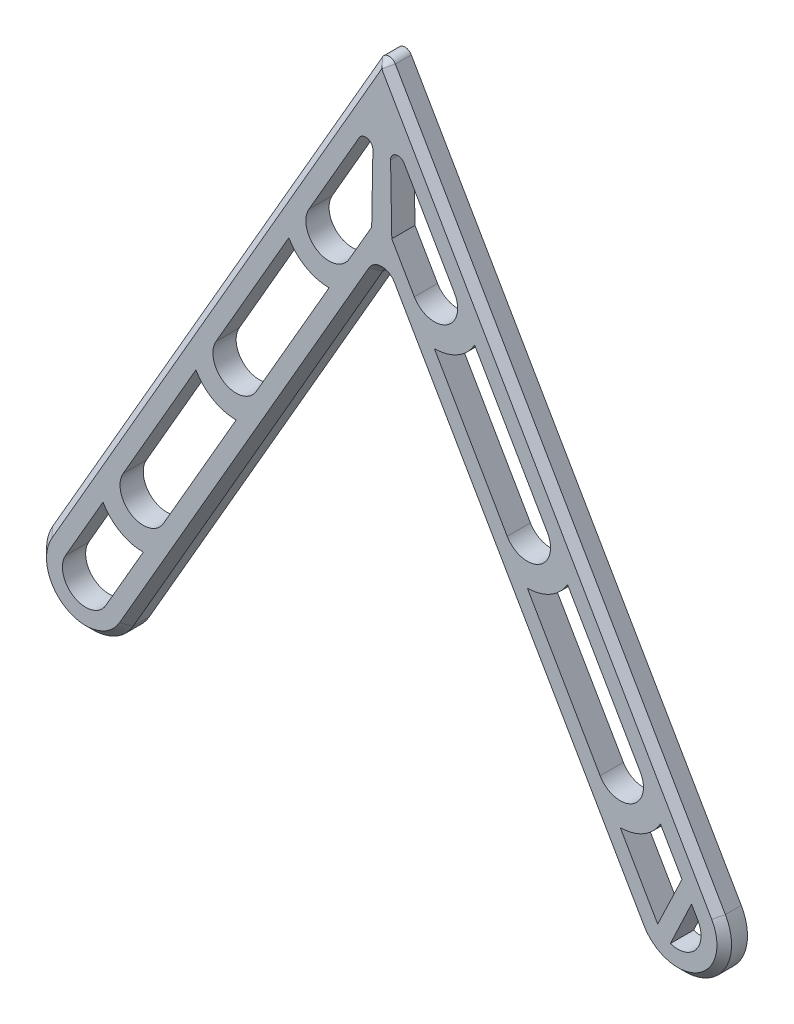
from build123d import *

# Parameters (mm, degrees)
BOSS_EXTRUDE1_DEPTH = 3.175
FILLET1_R           = 1
FILLET2_R           = 1
CHAMFER1_SIZE       = 1


with BuildPart() as part:
    # Sketch1 → Boss-Extrude1 (new body)
    with BuildSketch(Plane.XY):
        with BuildLine():
            Line((0, 0), (-45.974, -79.629303827))
            ThreePointArc((-45.974, -79.629303827), (-43.649738686, -88.303565141), (-34.975477372, -85.979303827))
            Line((-34.975477372, -85.979303827), (0, -25.4))
            Line((0, -25.4), (34.975477372, -85.979303827))
            ThreePointArc((34.975477372, -85.979303827), (43.649738686, -88.303565141), (45.974, -79.629303827))
            Line((45.974, -79.629303827), (0, 0))
        make_face()
        with BuildLine():
            Line((-1.139014765, -8.322831444), (-9.950369343, -23.584545256))
            ThreePointArc((-9.950369343, -23.584545256), (-8.788238686, -27.921675913), (-4.451108029, -26.759545256))
            Line((-4.451108029, -26.759545256), (-2.749630657, -23.8125))
            Line((-2.749630657, -23.8125), (-1.374815329, -21.43125))
            Line((-1.374815329, -21.43125), (-1.139014765, -8.322831444))
        make_face(mode=Mode.SUBTRACT)
        with BuildLine():
            Line((-38.1, -72.341135768), (-43.224369343, -81.216803827))
            ThreePointArc((-43.224369343, -81.216803827), (-42.062238686, -85.553934484), (-37.725108029, -84.391803827))
            Line((-37.725108029, -84.391803827), (-32.600738686, -75.516135768))
            ThreePointArc((-32.600738686, -75.516135768), (-35.775738686, -74.665397082), (-38.1, -72.341135768))
        make_face(mode=Mode.SUBTRACT)
        with BuildLine():
            Line((-19.900738686, -53.519090512), (-29.851108029, -70.753635768))
            ThreePointArc((-29.851108029, -70.753635768), (-34.188238686, -71.915766425), (-35.350369343, -67.578635768))
            Line((-35.350369343, -67.578635768), (-25.4, -50.344090512))
            ThreePointArc((-25.4, -50.344090512), (-23.075738686, -52.668351826), (-19.900738686, -53.519090512))
        make_face(mode=Mode.SUBTRACT)
        with BuildLine():
            Line((-7.200738686, -31.522045256), (-17.151108029, -48.756590512))
            ThreePointArc((-17.151108029, -48.756590512), (-21.488238686, -49.918721169), (-22.650369343, -45.581590512))
            Line((-22.650369343, -45.581590512), (-12.7, -28.347045256))
            ThreePointArc((-12.7, -28.347045256), (-10.375738686, -30.67130657), (-7.200738686, -31.522045256))
        make_face(mode=Mode.SUBTRACT)
        with BuildLine():
            Line((2.749630657, -23.8125), (1.374815329, -21.43125))
            Line((1.374815329, -21.43125), (1.139014765, -8.322831444))
            Line((1.139014765, -8.322831444), (9.950369343, -23.584545256))
            ThreePointArc((9.950369343, -23.584545256), (8.788238686, -27.921675913), (4.451108029, -26.759545256))
            Line((4.451108029, -26.759545256), (2.749630657, -23.8125))
        make_face(mode=Mode.SUBTRACT)
        with BuildLine():
            Line((12.7, -28.347045256), (22.650369343, -45.581590512))
            ThreePointArc((22.650369343, -45.581590512), (21.488238686, -49.918721169), (17.151108029, -48.756590512))
            Line((17.151108029, -48.756590512), (7.200738686, -31.522045256))
            ThreePointArc((7.200738686, -31.522045256), (10.375738686, -30.67130657), (12.7, -28.347045256))
        make_face(mode=Mode.SUBTRACT)
        with BuildLine():
            Line((25.4, -50.344090512), (35.350369343, -67.578635768))
            ThreePointArc((35.350369343, -67.578635768), (34.188238686, -71.915766425), (29.851108029, -70.753635768))
            Line((29.851108029, -70.753635768), (19.900738686, -53.519090512))
            ThreePointArc((19.900738686, -53.519090512), (23.075738686, -52.668351826), (25.4, -50.344090512))
        make_face(mode=Mode.SUBTRACT)
        with BuildLine():
            Line((32.600738686, -75.516135768), (37.725108029, -84.391803827))
            Line((37.725108029, -84.391803827), (41.041728895, -77.436359677))
            Line((41.041728895, -77.436359677), (38.1, -72.341135768))
            ThreePointArc((38.1, -72.341135768), (35.775738686, -74.665397082), (32.600738686, -75.516135768))
        make_face(mode=Mode.SUBTRACT)
        with BuildLine():
            Line((39.510088039, -85.709715542), (42.266670891, -79.871944556))
            Line((42.266670891, -79.871944556), (42.348213443, -79.699257294))
            Line((42.348213443, -79.699257294), (43.224369343, -81.216803827))
            ThreePointArc((43.224369343, -81.216803827), (42.931408354, -84.815621589), (39.461225977, -85.813193487))
            Line((39.461225977, -85.813193487), (39.510088039, -85.709715542))
        make_face(mode=Mode.SUBTRACT)
    extrude(amount=BOSS_EXTRUDE1_DEPTH)

    # Fillet1
    fillet1_edges = [part.edges().sort_by_distance(p)[0] for p in [
        (0, 0, 1.5875),
        (-1.139014765, -8.322831444, 1.5875),
        (1.139014765, -8.322831444, 1.5875),
    ]]
    fillet(fillet1_edges, radius=FILLET1_R)

    # Fillet2
    fillet2_edges = [part.edges().sort_by_distance(p)[0] for p in [
        (0, -25.4, 1.5875),
    ]]
    fillet(fillet2_edges, radius=FILLET2_R)

    # Chamfer1
    chamfer1_edges = [part.edges().sort_by_distance(p)[0] for p in [
        (-43.649738686, -88.303565141, 3.175),
        (-17.920751388, -56.439651914, 3.175),
        (-23.420012702, -40.564651914, 3.175),
        (0, -1, 3.175),
        (17.920751388, -56.439651914, 3.175),
        (0, -26.4, 3.175),
        (43.649738686, -88.303565141, 3.175),
        (23.420012702, -40.564651914, 3.175),
    ]]
    chamfer(chamfer1_edges, length=CHAMFER1_SIZE - 0.0001)  # a hair under: the kernel refuses the full size


solid = part.part
